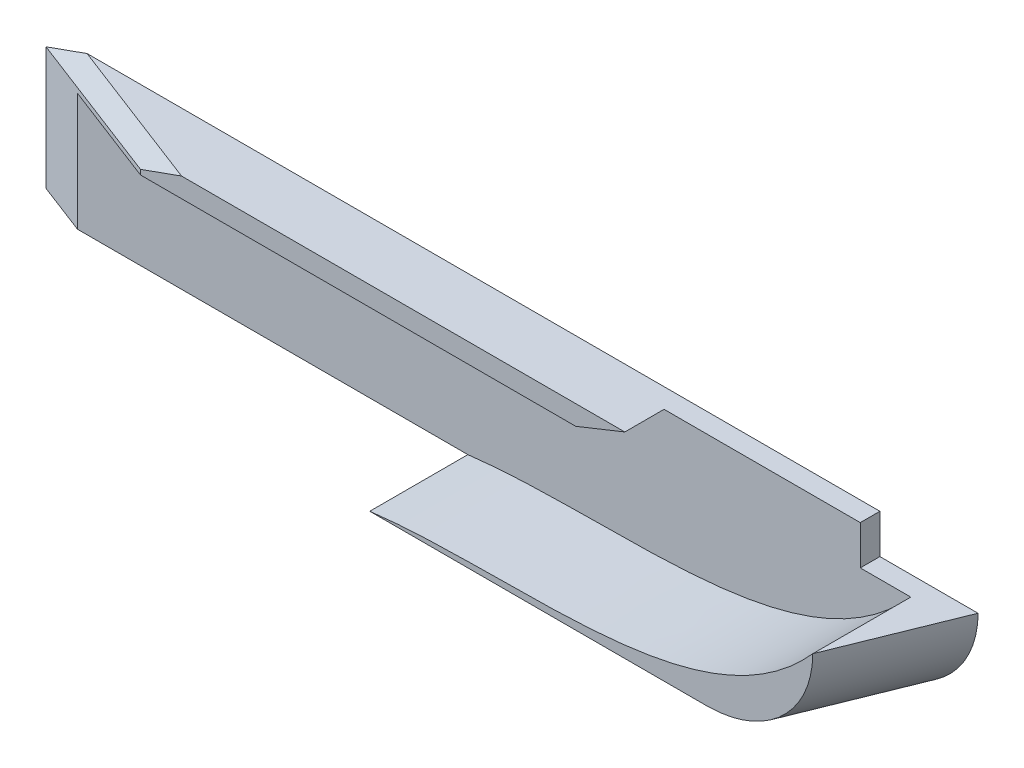
from build123d import *

# Parameters (mm, degrees)
SKETCH1_W           = 85
SKETCH1_H           = 14
BOSS_EXTRUDE1_DEPTH = 2
SKETCH2_W           = 85
SKETCH2_H           = 2
BOSS_EXTRUDE2_DEPTH = 6
SKETCH3_W           = 10
SKETCH3_H           = 10
BOSS_EXTRUDE3_DEPTH = 2
CUT_EXTRUDE1_DEPTH  = 4
CUT_EXTRUDE2_DEPTH  = 20
CHAMFER1_SIZE       = 1.5
SKETCH6_W           = 10
SKETCH6_H           = 10
BOSS_EXTRUDE4_DEPTH = 50
CUT_EXTRUDE3_DEPTH  = 50
FILLET1_R           = 10
CUT_EXTRUDE4_DEPTH  = 10


with BuildPart() as part:
    # Sketch1 → Boss-Extrude1 (new body)
    with BuildSketch(Plane.XY):
        with Locations((-9.558823529, 4.906862745)):
            Rectangle(SKETCH1_W, SKETCH1_H)
    extrude(amount=BOSS_EXTRUDE1_DEPTH)

    # Sketch2 → Boss-Extrude2 (add)
    with BuildSketch(Plane.XY):
        with Locations((-9.558823529, 10.906862745)):
            Rectangle(SKETCH2_W, SKETCH2_H)
    extrude(amount=BOSS_EXTRUDE2_DEPTH)

    # Sketch3 → Boss-Extrude3 (add)
    with BuildSketch(Plane(origin=(0, 0, 0), x_dir=(-1, 0, 0), z_dir=(0, 0, -1))):
        with Locations((-37.941176471, 2.906862745)):
            Rectangle(SKETCH3_W, SKETCH3_H)
    extrude(amount=-BOSS_EXTRUDE3_DEPTH)

    # Sketch4 → Cut-Extrude1 (cut)
    with BuildSketch(Plane.XY.offset(6)):
        Polygon((7.941176471, 9.906862745), (12.941176471, 11.906862745), (32.941176471, 11.906862745), (32.941176471, 9.906862745), align=None)
    extrude(amount=-CUT_EXTRUDE1_DEPTH, mode=Mode.SUBTRACT)

    # Sketch5 → Cut-Extrude2 (cut)
    with BuildSketch(Plane(origin=(0, 11.906862745, 0), x_dir=(1, 0, 0), z_dir=(0, 1, 0))):
        Polygon((-52.058823529, 0), (-36.428289141, -6), (-52.058823529, -6), align=None)
    extrude(amount=-CUT_EXTRUDE2_DEPTH, mode=Mode.SUBTRACT)

    # Chamfer1
    chamfer1_edges = [part.edges().sort_by_distance(p)[0] for p in [
        (-44.243556335, 11.906862745, 3),
    ]]
    chamfer(chamfer1_edges, length=CHAMFER1_SIZE)

    # Sketch6 → Boss-Extrude4 (add)
    with BuildSketch(Plane(origin=(42.941176471, 0, 0), x_dir=(0, 0, -1), z_dir=(1, 0, 0))):
        with Locations((-7, 2.906862745)):
            Rectangle(SKETCH6_W, SKETCH6_H)
    extrude(amount=-BOSS_EXTRUDE4_DEPTH)

    # Sketch7 → Cut-Extrude3 (cut)
    with BuildSketch(Plane.XZ.offset(2.093137255)):
        Polygon((42.941176471, 0), (38.092861761, 12), (42.941176471, 12), align=None)
    extrude(amount=-CUT_EXTRUDE3_DEPTH, mode=Mode.SUBTRACT)

    # Fillet1
    fillet1_edges = [part.edges().sort_by_distance(p)[0] for p in [
        (40.517019116, -2.093137255, 6),
    ]]
    fillet(fillet1_edges, radius=FILLET1_R - 0.0001)  # a hair under: the kernel refuses the full size

    # Sketch8 → Cut-Extrude4 (cut)
    with BuildSketch(Plane.XY.offset(12)):
        with BuildLine():
            Line((-7.058823529, -2.093137255), (-7.058823529, 7.906862745))
            Line((-7.058823529, 7.906862745), (38.092861761, 7.906862745))
            add(Edge.make_bspline(
                [(-7.058823529, -2.093137255), (8.253894017, -0.195900436), (26.879326583, -4.673987429), (38.092861761, 7.906862745)],
                knots=[0, 0, 0, 0, 1, 1, 1, 1], degree=3))
        make_face()
    extrude(amount=-CUT_EXTRUDE4_DEPTH, mode=Mode.SUBTRACT)


solid = part.part
